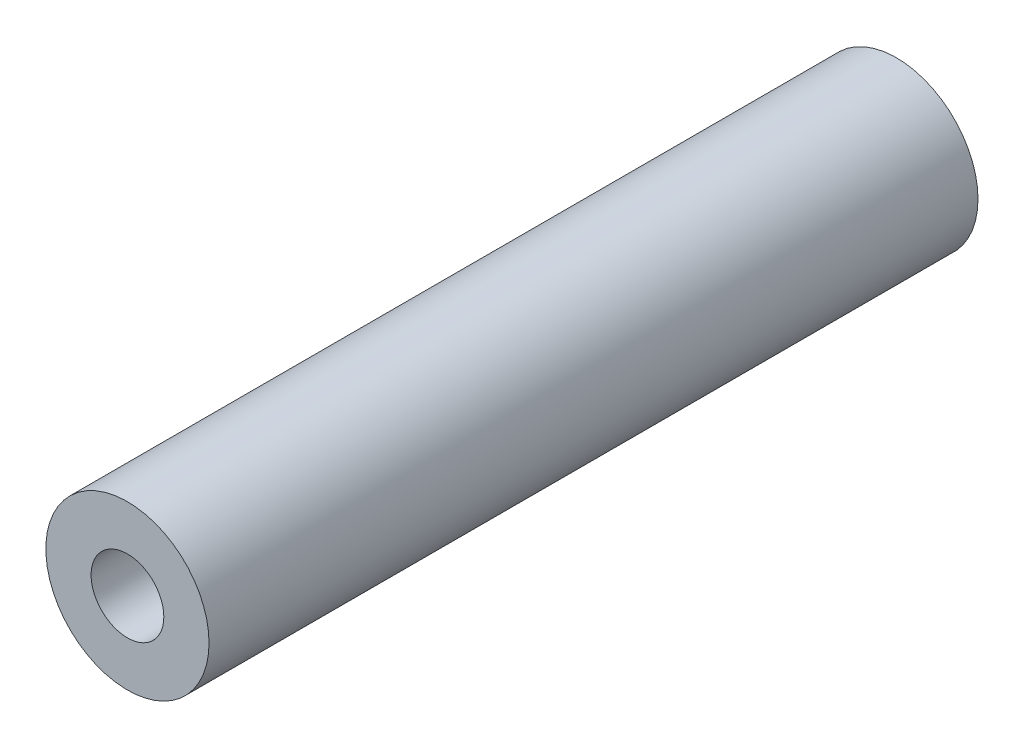
from build123d import *

# Parameters (mm, degrees)
SKETCH1_R           = 5.7277
SKETCH1_R_2         = 2.5527
BOSS_EXTRUDE1_DEPTH = 53.975


with BuildPart() as part:
    # Sketch1 → Boss-Extrude1 (new body)
    with BuildSketch(Plane.XY):
        Circle(SKETCH1_R)
        Circle(SKETCH1_R_2, mode=Mode.SUBTRACT)
    extrude(amount=BOSS_EXTRUDE1_DEPTH)


solid = part.part
